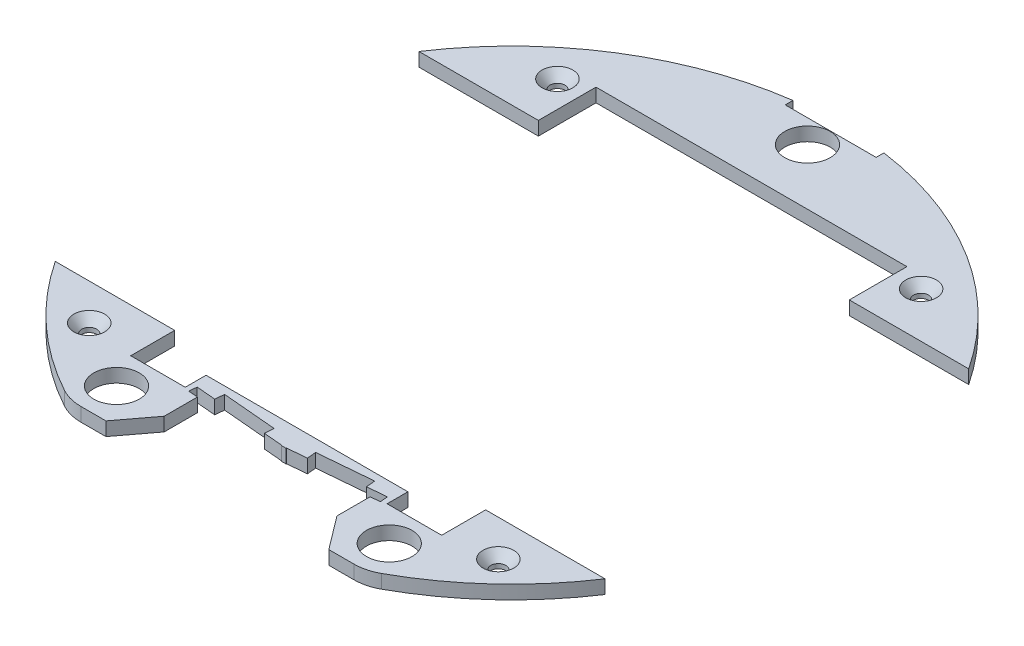
from build123d import *
from OCP.BRepFilletAPI import BRepFilletAPI_MakeChamfer

# Parameters (mm, degrees)
BOSS_EXTRUDE1_DEPTH = 3
CUT_EXTRUDE1_DEPTH  = 103.574363269
SKETCH3_W           = 38.3
SKETCH3_H           = 80
CUT_EXTRUDE2_DEPTH  = 103.574363269
CUT_EXTRUDE3_DEPTH  = 95.453692358
SKETCH5_W           = 38
SKETCH5_H           = 14.605577538
CUT_EXTRUDE4_DEPTH  = 95.453692358
SKETCH6_W           = 68.4
SKETCH6_H           = 3
CUT_EXTRUDE5_DEPTH  = 95.453692358
SKETCH7_R           = 5
CUT_EXTRUDE6_DEPTH  = 95.453692358
SKETCH11_R          = 5
CUT_EXTRUDE10_DEPTH = 95.453692358
CUT_EXTRUDE11_DEPTH = 95.453692358
SKETCH14_R          = 1.65
CUT_EXTRUDE12_DEPTH = 95.453692358
SKETCH15_W          = 20
SKETCH15_H          = 1.7
CUT_EXTRUDE13_DEPTH = 10
CHAMFER1_SIZE       = 2
CHAMFER1_SIZE2      = 1.738573476
CHAMFER2_SIZE       = 2
CHAMFER2_SIZE2      = 1.738573476


with BuildPart() as part:
    # Sketch1 → Boss-Extrude1 (new body)
    with BuildSketch(Plane(origin=(0, 0, 0), x_dir=(1, 0, 0), z_dir=(0, 1, 0))):
        with BuildLine():
            Line((-30.029977361, -64.812867647), (30.029977361, -64.812867647))
            ThreePointArc((30.029977361, -64.812867647), (32.509837414, -64.500503794), (34.834773739, -63.582926471))
            ThreePointArc((34.834773739, -63.582926471), (0, 72.5), (-34.834773739, -63.582926471))
            ThreePointArc((-34.834773739, -63.582926471), (-32.509837414, -64.500503794), (-30.029977361, -64.812867647))
        make_face()
    extrude(amount=BOSS_EXTRUDE1_DEPTH)

    # Sketch2 → Cut-Extrude1 (cut, through all)
    with BuildSketch(Plane(origin=(0, 3, 0), x_dir=(1, 0, 0), z_dir=(0, 1, 0))):
        Polygon((22.2, -45.1), (22.2, -49.675685802), (34.2, -49.675685802), (34.2, 49.675685802), (22.2, 49.675685802), (22.2, 45.5), (-22.2, 45.5), (-22.2, 49.675685802), (-34.2, 49.675685802), (-34.2, -49.675685802), (-22.2, -49.675685802), (-22.2, -45.1), align=None)
    extrude(amount=-CUT_EXTRUDE1_DEPTH, mode=Mode.SUBTRACT)

    # Sketch3 → Cut-Extrude2 (cut, through all)
    with BuildSketch(Plane(origin=(0, 3, 0), x_dir=(1, 0, 0), z_dir=(0, 1, 0))):
        with Locations((-53.35, 0)):
            Rectangle(SKETCH3_W, SKETCH3_H)
        with Locations((53.35, 0)):
            Rectangle(SKETCH3_W, SKETCH3_H)
    extrude(amount=-CUT_EXTRUDE2_DEPTH, mode=Mode.SUBTRACT)


with BuildPart() as cut_extrude2_piece_1:
    # of the separate pieces the step leaves, piece 1, a body of its own (cut_extrude2_pieces)
    add(part.part.solids().sort_by_distance((60.466933112, 0, -40))[0])

    # Sketch6 → Cut-Extrude5 (cut, through all)
    with BuildSketch(Plane(origin=(0, 3, 0), x_dir=(1, 0, 0), z_dir=(0, 1, 0))):
        with Locations((0, 51.175685802)):
            Rectangle(SKETCH6_W, SKETCH6_H)
    extrude(amount=-CUT_EXTRUDE5_DEPTH, mode=Mode.SUBTRACT)


with BuildPart() as cut_extrude2_piece_2:
    # of the separate pieces the step leaves, piece 2, a body of its own (cut_extrude2_pieces)
    add(part.part.solids().sort_by_distance((-34.834773739, 0, 63.582926471))[0])

    # Sketch4 → Cut-Extrude3 (cut, through all)
    with BuildSketch(Plane(origin=(0, 3, 0), x_dir=(1, 0, 0), z_dir=(0, 1, 0))):
        Polygon((-21.070156074, -50.026174921), (-0.648164763, -51.812867647), (-0.5, -50.11933666), (-20.921991311, -48.332643934), align=None)
        Polygon((21.070156074, -50.026174921), (20.921991311, -48.332643934), (0.5, -50.11933666), (0.648164763, -51.812867647), align=None)
    extrude(amount=-CUT_EXTRUDE3_DEPTH, mode=Mode.SUBTRACT)

    # Sketch5 → Cut-Extrude4 (cut, through all)
    with BuildSketch(Plane(origin=(0, 3, 0), x_dir=(1, 0, 0), z_dir=(0, 1, 0))):
        with Locations((0, -57.510078878)):
            Rectangle(SKETCH5_W, SKETCH5_H)
        Polygon((16.688163844, -48.703055841), (4.733827467, -49.748924754), (4.559515981, -47.756535357), (16.513852358, -46.710666444), align=None)
        Polygon((-16.513852358, -46.710666444), (-4.559515981, -47.756535357), (-4.733827467, -49.748924754), (-16.688163844, -48.703055841), align=None)
    extrude(amount=-CUT_EXTRUDE4_DEPTH, mode=Mode.SUBTRACT)

    # Sketch7 → Cut-Extrude6 (cut, through all)
    with BuildSketch(Plane(origin=(0, 3, 0), x_dir=(1, 0, 0), z_dir=(0, 1, 0))):
        with Locations((-30, -57)):
            Circle(SKETCH7_R)
        with Locations((30, -57)):
            Circle(SKETCH7_R)
    extrude(amount=-CUT_EXTRUDE6_DEPTH, mode=Mode.SUBTRACT)

    # Sketch13 → Cut-Extrude11 (cut, through all)
    with BuildSketch(Plane(origin=(0, 3, 0), x_dir=(1, 0, 0), z_dir=(0, 1, 0))):
        Polygon((19, -57.510078878), (24.514988681, -64.812867647), (19, -64.812867647), align=None)
        Polygon((-19, -64.812867647), (-19, -57.510078878), (-24.514988681, -64.812867647), align=None)
    extrude(amount=-CUT_EXTRUDE11_DEPTH, mode=Mode.SUBTRACT)


with BuildPart() as cut_extrude5_kept_piece:
    # of the separate pieces the step leaves, the one the design keeps (cut_extrude5_pieces_kept)
    add(cut_extrude2_piece_1.part.solids().sort_by_distance((60.466933112, 0, -40))[0])

    # Sketch11 → Cut-Extrude10 (cut, through all)
    with BuildSketch(Plane(origin=(0, 3, 0), x_dir=(1, 0, 0), z_dir=(0, 1, 0))):
        with Locations((0, 65)):
            Circle(SKETCH11_R)
    extrude(amount=-CUT_EXTRUDE10_DEPTH, mode=Mode.SUBTRACT)


with BuildPart() as cut_extrude12_tool:
    # Sketch14 → Cut-Extrude12 (new, through all)
    with BuildSketch(Plane(origin=(0, 3, 0), x_dir=(1, 0, 0), z_dir=(0, 1, 0))):
        with Locations((45, -48)):
            Circle(SKETCH14_R)
        with Locations((-45, -48)):
            Circle(SKETCH14_R)
        with Locations((40, 50)):
            Circle(SKETCH14_R)
        with Locations((-40, 50)):
            Circle(SKETCH14_R)
    extrude(amount=-CUT_EXTRUDE12_DEPTH)


with BuildPart() as cut_extrude2_piece_2_1:
    add(cut_extrude2_piece_2.part)

    # Cut-Extrude12: cut by cut_extrude12_tool
    add(cut_extrude12_tool.part, mode=Mode.SUBTRACT)

    # Chamfer1: one chamfer whose edges measure the first distance from different faces: ONE call of the kernel's chamfer builder (chamfer() names one face for all edges)
    chamfer1_edges_1 = [cut_extrude2_piece_2_1.edges().sort_by_distance(p)[0] for p in [
        (-46.65, 3, 48),
    ]]
    chamfer1_side_1 = [cut_extrude2_piece_2_1.faces().sort_by_distance(p)[0] for p in [
        (-46.65, 1.5, 48),
    ]]
    chamfer1_edges_2 = [cut_extrude2_piece_2_1.edges().sort_by_distance(p)[0] for p in [
        (43.35, 3, 48),
    ]]
    chamfer1_side_2 = [cut_extrude2_piece_2_1.faces().sort_by_distance(p)[0] for p in [
        (43.35, 1.5, 48),
    ]]
    chamfer1 = BRepFilletAPI_MakeChamfer(cut_extrude2_piece_2_1.part.solid().wrapped)
    for e in chamfer1_edges_1:
        chamfer1.Add(CHAMFER1_SIZE, CHAMFER1_SIZE2, e.wrapped, chamfer1_side_1[0].wrapped)  # the first distance lies on this face
    for e in chamfer1_edges_2:
        chamfer1.Add(CHAMFER1_SIZE, CHAMFER1_SIZE2, e.wrapped, chamfer1_side_2[0].wrapped)  # the first distance lies on this face
    add(Compound.cast(chamfer1.Shape()), mode=Mode.REPLACE)


with BuildPart() as cut_extrude5_kept_piece_1:
    add(cut_extrude5_kept_piece.part)

    # Cut-Extrude12: cut by cut_extrude12_tool
    add(cut_extrude12_tool.part, mode=Mode.SUBTRACT)

    # Sketch15 → Cut-Extrude13 (cut)
    with BuildSketch(Plane(origin=(0, 3, 0), x_dir=(1, 0, 0), z_dir=(0, 1, 0))):
        with Locations((0, 70.957033082)):
            Rectangle(SKETCH15_W, SKETCH15_H)
    extrude(amount=-CUT_EXTRUDE13_DEPTH, mode=Mode.SUBTRACT)


with BuildPart() as body_3:
    # of the pieces the cut leaves, the one that is kept (cut_extrude13_keep)
    add(cut_extrude5_kept_piece_1.part.solids().sort_by_distance((60.466933112, 0, -40))[0])

    # Chamfer2: one chamfer whose edges measure the first distance from different faces: ONE call of the kernel's chamfer builder (chamfer() names one face for all edges)
    chamfer2_edges_1 = [body_3.edges().sort_by_distance(p)[0] for p in [
        (-41.65, 3, -50),
    ]]
    chamfer2_side_1 = [body_3.faces().sort_by_distance(p)[0] for p in [
        (-41.65, 1.5, -50),
    ]]
    chamfer2_edges_2 = [body_3.edges().sort_by_distance(p)[0] for p in [
        (38.35, 3, -50),
    ]]
    chamfer2_side_2 = [body_3.faces().sort_by_distance(p)[0] for p in [
        (38.35, 1.5, -50),
    ]]
    chamfer2 = BRepFilletAPI_MakeChamfer(body_3.part.solid().wrapped)
    for e in chamfer2_edges_1:
        chamfer2.Add(CHAMFER2_SIZE, CHAMFER2_SIZE2, e.wrapped, chamfer2_side_1[0].wrapped)  # the first distance lies on this face
    for e in chamfer2_edges_2:
        chamfer2.Add(CHAMFER2_SIZE, CHAMFER2_SIZE2, e.wrapped, chamfer2_side_2[0].wrapped)  # the first distance lies on this face
    add(Compound.cast(chamfer2.Shape()), mode=Mode.REPLACE)


solid = Compound([cut_extrude2_piece_2_1.part, body_3.part])
